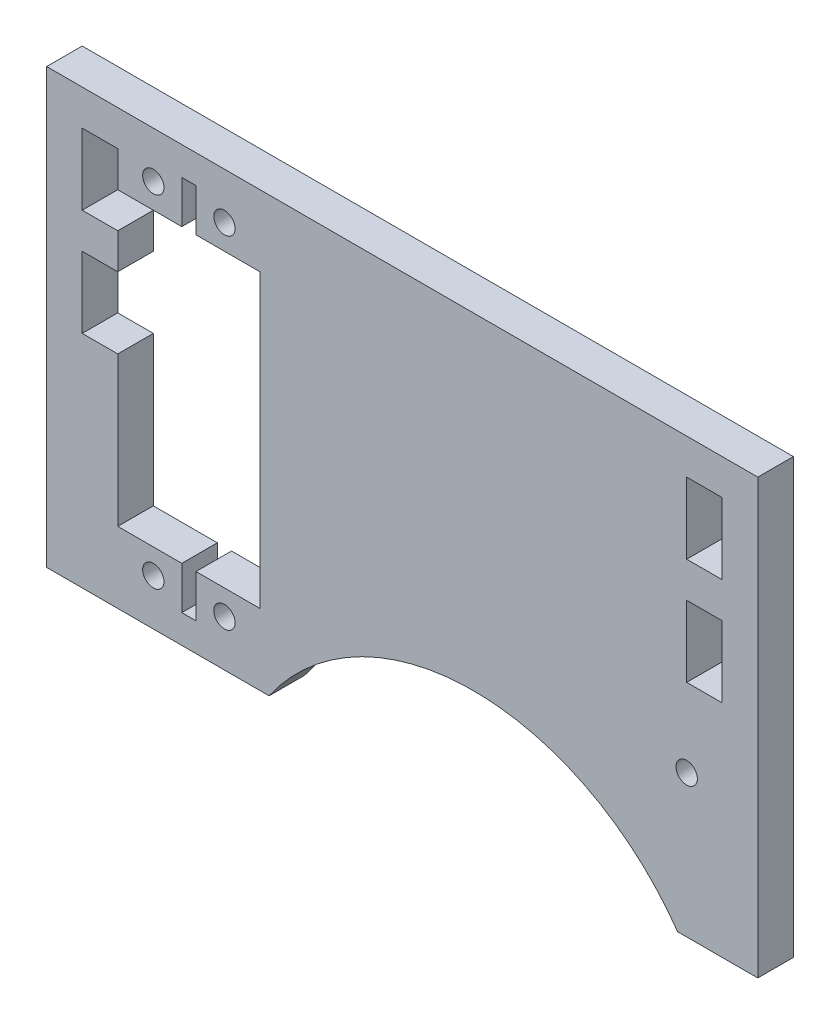
from build123d import *

# Parameters (mm, degrees)
ESQUISSE1_R        = 1.5
ESQUISSE1_W        = 5
ESQUISSE1_H        = 10
BOSS_EXTRU_1_DEPTH = 5


with BuildPart() as part:
    # Esquisse1 → Boss.-Extru.1 (new body)
    with BuildSketch(Plane.XY):
        with BuildLine():
            Line((0, 0), (31.277186767, 0))
            ThreePointArc((31.277186767, 0), (60, 15), (88.722813233, 0))
            Line((88.722813233, 0), (100, 0))
            Line((100, 0), (100, 61))
            Line((100, 61), (0, 61))
            Line((0, 61), (0, 0))
        make_face()
        with Locations((15, 6.5)):
            Circle(ESQUISSE1_R, mode=Mode.SUBTRACT)
        with Locations((25, 6.5)):
            Circle(ESQUISSE1_R, mode=Mode.SUBTRACT)
        with Locations((25, 54.5)):
            Circle(ESQUISSE1_R, mode=Mode.SUBTRACT)
        with Locations((15, 54.5)):
            Circle(ESQUISSE1_R, mode=Mode.SUBTRACT)
        with Locations((90, 20)):
            Circle(ESQUISSE1_R, mode=Mode.SUBTRACT)
        Polygon((10, 51), (19, 51), (19, 57), (21, 57), (21, 51), (30, 51), (30, 10), (21, 10), (21, 4), (19, 4), (19, 10), (10, 10), (10, 31), (5, 31), (5, 41), (10, 41), (10, 46), (5, 46), (5, 56), (10, 56), align=None, mode=Mode.SUBTRACT)
        with Locations((92.5, 51)):
            Rectangle(ESQUISSE1_W, ESQUISSE1_H, mode=Mode.SUBTRACT)
        with Locations((92.5, 36)):
            Rectangle(ESQUISSE1_W, ESQUISSE1_H, mode=Mode.SUBTRACT)
    extrude(amount=BOSS_EXTRU_1_DEPTH)


solid = part.part
